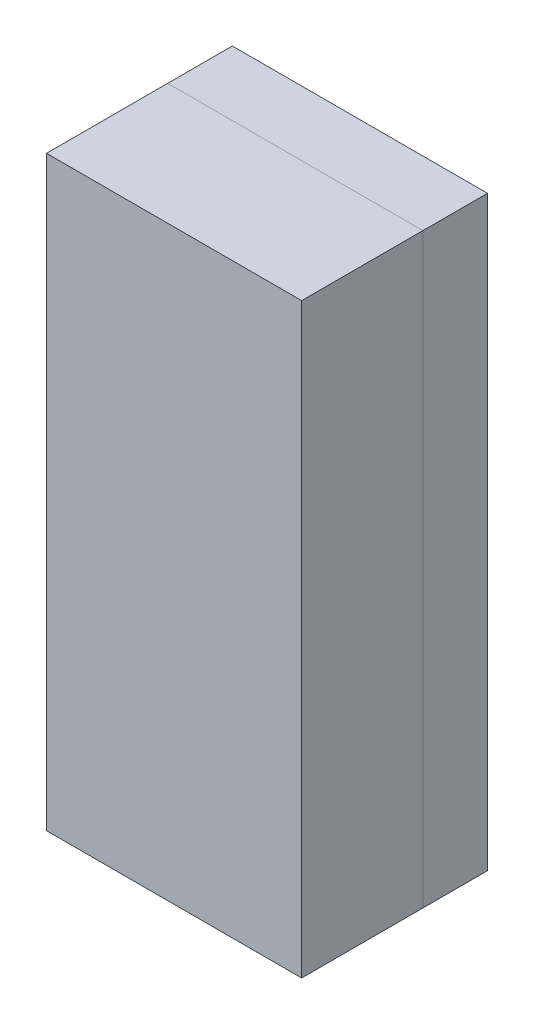
from build123d import *

# Parameters (mm, degrees)
CROQUIS1_W                    = 50
CROQUIS1_H                    = 200
SALIENTE_EXTRUIR1_DEPTH       = 30
CORTAR_EXTRUIR1_DEPTH         = 60
CROQUIS3_W                    = 20
CROQUIS3_H                    = 30
SALIENTE_EXTRUIR2_DEPTH       = 5
REDONDEO1_R                   = 10
REDONDEO2_R                   = 10
CROQUIS5_W                    = 6
CROQUIS5_H                    = 6
CROQUIS5_R                    = 8
CROQUIS5_R_2                  = 4
SALIENTE_EXTRUIR3_DEPTH       = 5
ESCALA2_SCALE                 = 1.5
N_CLEO_CAVIDAD2_START         = -78.945007696
N_CLEO_CAVIDAD2_DEPTH         = 157.890015392
N_CLEO_CAVIDAD2_2_DEPTH       = 41.445120732
N_CLEO_CAVIDAD2_START_2       = 37.500113036
N_CLEO_CAVIDAD2_3_DEPTH       = 41.44489466
N_CLEO_CAVIDAD2_START_3       = -37.499886964
N_CLEO_CAVIDAD2_4_DEPTH       = 22.5
N_CLEO_CAVIDAD2_START_4       = 15.000113036
N_CLEO_CAVIDAD2_5_DEPTH       = 22.5
N_CLEO_CAVIDAD2_START_5       = -47.172761026
N_CLEO_CAVIDAD2_6_OUTLINE_W   = 157.890015392
N_CLEO_CAVIDAD2_6_OUTLINE_H   = 363.034016882
N_CLEO_CAVIDAD2_6_OUTLINE_W_2 = 9
N_CLEO_CAVIDAD2_6_OUTLINE_H_2 = 9
N_CLEO_CAVIDAD2_6_OUTLINE_R   = 6
N_CLEO_CAVIDAD2_6_OUTLINE_R_2 = 12
N_CLEO_CAVIDAD2_6_DEPTH       = 40
N_CLEO_CAVIDAD2_7_OUTLINE_R   = 12
N_CLEO_CAVIDAD2_7_OUTLINE_R_2 = 6
N_CLEO_CAVIDAD2_7_OUTLINE_W   = 9
N_CLEO_CAVIDAD2_7_OUTLINE_H   = 9
N_CLEO_CAVIDAD2_7_DEPTH       = 32.5


# Read off the part's stored shape, not the designer's step: Núcleo/Cavidad2
with BuildPart() as part:
    # Croquis1 → Saliente-Extruir1 (new body)
    with BuildSketch(Plane.XY):
        Rectangle(CROQUIS1_W, CROQUIS1_H)
    extrude(amount=SALIENTE_EXTRUIR1_DEPTH)

    # Croquis2 → Cortar-Extruir1 (cut)
    with BuildSketch(Plane.ZY.offset(25)):
        Polygon((15, 100), (30, 60.706463385), (30, 100), align=None)
    extrude(amount=-CORTAR_EXTRUIR1_DEPTH, mode=Mode.SUBTRACT)

    # Croquis3 → Saliente-Extruir2 (add)
    with BuildSketch(Plane(origin=(0, 17.716995079, 46.41089299), x_dir=(1, 0, 0), z_dir=(0, 0.356639588239418, 0.9342420479192843))):
        with Locations((0, 67.044976998)):
            Rectangle(CROQUIS3_W, CROQUIS3_H)
    extrude(amount=SALIENTE_EXTRUIR2_DEPTH)

    # Redondeo1
    # the kernel refuses this fillet: 10 mm, written as the material it takes off along each edge
    with BuildSketch(Plane(origin=(-29.60955221, 60.706463385, 30), x_dir=(0, -1, 0), z_dir=(1, 0, 0))) as redondeo1_piece_1:
        with BuildLine():
            CenterArc((REDONDEO1_R * 0.184382088386, REDONDEO1_R), REDONDEO1_R, 249.106035538, 20.893964462)
            Line((-REDONDEO1_R * 0.172257499853, REDONDEO1_R * 0.0657579520807), (0, 0))
            Line((0, 0), (REDONDEO1_R * 0.184382088386, 0))
        make_face()
    extrude(amount=59.219104419, mode=Mode.SUBTRACT)
    with BuildSketch(Plane(origin=(-42.216106179, 100, 15), x_dir=(0, -0.934242047919284, 0.3566395882394187), z_dir=(1, 0, 0))) as redondeo1_piece_2_section:
        with BuildLine():
            CenterArc((REDONDEO1_R * 0.688644247166, REDONDEO1_R), REDONDEO1_R, 200.893964462, 69.106035538)
            Line((-REDONDEO1_R * 0.245597800753, REDONDEO1_R * 0.643360411761), (0, 0))
            Line((0, 0), (REDONDEO1_R * 0.688644247166, 0))
        make_face()
    redondeo1_piece_2 = extrude(amount=84.432212358, mode=Mode.PRIVATE)
    redondeo1_piece_2 = split(redondeo1_piece_2, bisect_by=Plane(origin=(-10, 94.011560914, 17.386219939), z_dir=(-1, 0, 0)), keep=Keep.TOP, mode=Mode.PRIVATE)
    redondeo1_piece_2 = split(redondeo1_piece_2, bisect_by=Plane(origin=(-26.10805309, 94.400241221, 17.237844274), z_dir=(0, -0.9342420479192843, 0.35663958823941805)), keep=Keep.TOP, mode=Mode.PRIVATE)
    add(redondeo1_piece_2, mode=Mode.SUBTRACT)
    with BuildSketch(Plane(origin=(-42.216106179, 100, 15), x_dir=(0, -0.934242047919284, 0.3566395882394187), z_dir=(1, 0, 0))) as redondeo1_piece_3_section:
        with BuildLine():
            CenterArc((REDONDEO1_R * 0.688644247166, REDONDEO1_R), REDONDEO1_R, 200.893964462, 69.106035538)
            Line((-REDONDEO1_R * 0.245597800753, REDONDEO1_R * 0.643360411761), (0, 0))
            Line((0, 0), (REDONDEO1_R * 0.688644247166, 0))
        make_face()
    redondeo1_piece_3 = extrude(amount=84.432212358, mode=Mode.PRIVATE)
    redondeo1_piece_3 = split(redondeo1_piece_3, bisect_by=Plane(origin=(-10, 98.665500542, 13.974903393), z_dir=(-1, 0, 0)), keep=Keep.TOP, mode=Mode.PRIVATE)
    redondeo1_piece_3 = split(redondeo1_piece_3, bisect_by=Plane(origin=(-26.10805309, 93.855575449, 15.811054644), z_dir=(0, 0.9342420479192843, -0.35663958823941805)), keep=Keep.TOP, mode=Mode.PRIVATE)
    add(redondeo1_piece_3, mode=Mode.SUBTRACT)
    with BuildSketch(Plane(origin=(-42.216106179, 100, 15), x_dir=(0, -0.934242047919284, 0.3566395882394187), z_dir=(1, 0, 0))) as redondeo1_piece_4_section:
        with BuildLine():
            CenterArc((REDONDEO1_R * 0.688644247166, REDONDEO1_R), REDONDEO1_R, 200.893964462, 69.106035538)
            Line((-REDONDEO1_R * 0.245597800753, REDONDEO1_R * 0.643360411761), (0, 0))
            Line((0, 0), (REDONDEO1_R * 0.688644247166, 0))
        make_face()
    redondeo1_piece_4 = extrude(amount=84.432212358, mode=Mode.PRIVATE)
    redondeo1_piece_4 = split(redondeo1_piece_4, bisect_by=Plane(origin=(-10, 98.665500542, 13.974903393), z_dir=(1, 0, 0)), keep=Keep.TOP, mode=Mode.PRIVATE)
    redondeo1_piece_4 = split(redondeo1_piece_4, bisect_by=Plane(origin=(0, 93.855575449, 15.811054644), z_dir=(0, 0.9342420479192843, -0.35663958823941805)), keep=Keep.TOP, mode=Mode.PRIVATE)
    redondeo1_piece_4 = split(redondeo1_piece_4, bisect_by=Plane(origin=(10, 98.665500542, 13.974903393), z_dir=(-1, 0, 0)), keep=Keep.TOP, mode=Mode.PRIVATE)
    add(redondeo1_piece_4, mode=Mode.SUBTRACT)
    with BuildSketch(Plane(origin=(-42.216106179, 100, 15), x_dir=(0, -0.934242047919284, 0.3566395882394187), z_dir=(1, 0, 0))) as redondeo1_piece_5_section:
        with BuildLine():
            CenterArc((REDONDEO1_R * 0.688644247166, REDONDEO1_R), REDONDEO1_R, 200.893964462, 69.106035538)
            Line((-REDONDEO1_R * 0.245597800753, REDONDEO1_R * 0.643360411761), (0, 0))
            Line((0, 0), (REDONDEO1_R * 0.688644247166, 0))
        make_face()
    redondeo1_piece_5 = extrude(amount=84.432212358, mode=Mode.PRIVATE)
    redondeo1_piece_5 = split(redondeo1_piece_5, bisect_by=Plane(origin=(26.10805309, 94.400241221, 17.237844274), z_dir=(0, -0.9342420479192843, 0.35663958823941805)), keep=Keep.TOP, mode=Mode.PRIVATE)
    redondeo1_piece_5 = split(redondeo1_piece_5, bisect_by=Plane(origin=(10, 94.011560914, 17.386219939), z_dir=(1, 0, 0)), keep=Keep.TOP, mode=Mode.PRIVATE)
    add(redondeo1_piece_5, mode=Mode.SUBTRACT)
    with BuildSketch(Plane(origin=(-42.216106179, 100, 15), x_dir=(0, -0.934242047919284, 0.3566395882394187), z_dir=(1, 0, 0))) as redondeo1_piece_6_section:
        with BuildLine():
            CenterArc((REDONDEO1_R * 0.688644247166, REDONDEO1_R), REDONDEO1_R, 200.893964462, 69.106035538)
            Line((-REDONDEO1_R * 0.245597800753, REDONDEO1_R * 0.643360411761), (0, 0))
            Line((0, 0), (REDONDEO1_R * 0.688644247166, 0))
        make_face()
    redondeo1_piece_6 = extrude(amount=84.432212358, mode=Mode.PRIVATE)
    redondeo1_piece_6 = split(redondeo1_piece_6, bisect_by=Plane(origin=(26.10805309, 93.855575449, 15.811054644), z_dir=(0, 0.9342420479192843, -0.35663958823941805)), keep=Keep.TOP, mode=Mode.PRIVATE)
    redondeo1_piece_6 = split(redondeo1_piece_6, bisect_by=Plane(origin=(10, 98.665500542, 13.974903393), z_dir=(1, 0, 0)), keep=Keep.TOP, mode=Mode.PRIVATE)
    add(redondeo1_piece_6, mode=Mode.SUBTRACT)

    # Redondeo2
    # the kernel refuses this fillet: 10 mm, written as the material it takes off along each edge
    with BuildSketch(Plane(origin=(31.650635095, 68.122798915, 32.520804063), x_dir=(0, 0.9342420479192848, -0.3566395882394171), z_dir=(-1, 0, 0))) as redondeo2_piece_1:
        with BuildLine():
            CenterArc((8.660254038, 10), REDONDEO2_R, 210, 60)
            Line((0, 5), (-0.173205081, 4.9))
            ThreePointArc((-0.173205081, 4.9), (-0.2, 2.5), (-0.2, 0))
            Line((-0.2, 0), (0, -0.2))
            Line((0, -0.2), (8.660254038, -0.2))
            Line((8.660254038, -0.2), (8.660254038, 0))
        make_face()
    extrude(amount=63.301270189, mode=Mode.SUBTRACT)
    with BuildSketch(Plane(origin=(-31.703453679, 96.150060353, 21.821616416), x_dir=(0, -0.3566395882395135, -0.9342420479192478), z_dir=(1, 0, 0))) as redondeo2_piece_2:
        with BuildLine():
            CenterArc((10, -8.681381471), REDONDEO2_R, 119.757004223, 60.242995777)
            Line((0, -8.681381471), (-0.2, -8.681381471))
            Line((-0.2, -8.681381471), (-0.2, 0))
            Line((-0.2, 0), (0, 0.2))
            ThreePointArc((0, 0.2), (2.518386828, 0.2), (4.937509129, 0.173627629))
            Line((4.937509129, 0.173627629), (5.036773655, 0))
        make_face()
    extrude(amount=63.406907357, mode=Mode.SUBTRACT)

    # Croquis5 → Saliente-Extruir3 (add)
    with BuildSketch(Plane(origin=(0, 0, 0), x_dir=(-1, 0, 0), z_dir=(0, 0, -1))):
        Polygon((-2.5, 80), (-2.5, 72.5), (-10, 72.5), (-10, 67.5), (-2.5, 67.5), (-2.5, 60), (2.5, 60), (2.5, 67.5), (10, 67.5), (10, 72.5), (2.5, 72.5), (2.5, 80), align=None)
        with Locations((-17.908573371, -75.072215566)):
            Rectangle(CROQUIS5_W, CROQUIS5_H)
        with Locations((18.091426629, -75.072215566)):
            Rectangle(CROQUIS5_W, CROQUIS5_H)
        with Locations((-5.908573371, -75.072215566)):
            Rectangle(CROQUIS5_W, CROQUIS5_H)
        with Locations((6.091426629, -75.072215566)):
            Rectangle(CROQUIS5_W, CROQUIS5_H)
        with Locations(Location((0, 26, 0), (0, 0, 180))):
            Circle(CROQUIS5_R)
        with Locations(Location((0, 0, 0), (0, 0, 180))):
            Circle(CROQUIS5_R_2)
        with Locations(Location((-12.5, 0, 0), (0, 0, 180))):
            Circle(CROQUIS5_R_2)
        with Locations(Location((12.5, 0, 0), (0, 0, 180))):
            Circle(CROQUIS5_R_2)
        with Locations(Location((0, -50, 0), (0, 0, 180))):
            Circle(CROQUIS5_R_2)
        with Locations(Location((0, -62.5, 0), (0, 0, 180))):
            Circle(CROQUIS5_R_2)
    extrude(amount=SALIENTE_EXTRUIR3_DEPTH)


with BuildPart() as part_1:
    # Escala2: scaled about (-0.000226072, -3.832135101, 14.345522052)
    add(part.part.scale(ESCALA2_SCALE).moved(Location((0.000113036, 1.91606755, -7.172761026))))


with BuildPart() as body_2:
    # Núcleo/Cavidad2 outline → Núcleo/Cavidad2 (new body)
    with BuildSketch(Plane.YZ.offset(N_CLEO_CAVIDAD2_START)):
        with BuildLine():
            Line((181.517008441, 67.827238974), (-181.517008441, 67.827238974))
            Line((-181.517008441, 67.827238974), (-181.517008441, -7.172761026))
            Line((-181.517008441, -7.172761026), (-148.08393245, -7.172761026))
            Line((-148.08393245, -7.172761026), (-148.08393245, 37.827238974))
            Line((-148.08393245, 37.827238974), (90.210031302, 37.827238974))
            ThreePointArc((90.210031302, 37.827238974), (92.929915419, 37.578585705), (95.559625126, 36.840869693))
            Line((95.559625126, 36.840869693), (101.425469011, 34.601629709))
            ThreePointArc((101.425469011, 34.601629709), (108.512901093, 37.772887312), (116.236426125, 36.975560917))
            Line((116.236426125, 36.975560917), (133.975390672, 30.203850068))
            ThreePointArc((133.975390672, 30.203850068), (140.285533356, 25.626878958), (143.446688755, 18.501314996))
            ThreePointArc((143.446688755, 18.501314996), (149.623532248, 12.967540195), (151.91606755, 4.997575266))
            Line((151.91606755, 4.997575266), (151.91606755, -7.172761026))
            Line((151.91606755, -7.172761026), (181.517008441, -7.172761026))
            Line((181.517008441, -7.172761026), (181.517008441, 67.827238974))
        make_face()
    extrude(amount=N_CLEO_CAVIDAD2_DEPTH)

    # N_cleo_Cavidad2 2 outline → N_cleo_Cavidad2 2 (add)
    with BuildSketch(Plane.YZ.offset(N_CLEO_CAVIDAD2_START)):
        with BuildLine():
            Line((-148.08393245, 37.827238974), (-148.08393245, -7.172761026))
            Line((-148.08393245, -7.172761026), (151.91606755, -7.172761026))
            Line((151.91606755, -7.172761026), (151.91606755, 4.997575266))
            ThreePointArc((151.91606755, 4.997575266), (149.623532248, 12.967540195), (143.446688755, 18.501314996))
            ThreePointArc((143.446688755, 18.501314996), (140.285533356, 25.626878958), (133.975390672, 30.203850068))
            Line((133.975390672, 30.203850068), (116.236426125, 36.975560917))
            ThreePointArc((116.236426125, 36.975560917), (108.512901093, 37.772887312), (101.425469011, 34.601629709))
            Line((101.425469011, 34.601629709), (95.559625126, 36.840869693))
            ThreePointArc((95.559625126, 36.840869693), (92.929915419, 37.578585705), (90.210031302, 37.827238974))
            Line((90.210031302, 37.827238974), (-148.08393245, 37.827238974))
        make_face()
    extrude(amount=N_CLEO_CAVIDAD2_2_DEPTH)

    # N_cleo_Cavidad2 3 outline → N_cleo_Cavidad2 3 (add)
    with BuildSketch(Plane.YZ.offset(N_CLEO_CAVIDAD2_START_2)):
        with BuildLine():
            Line((-148.08393245, 37.827238974), (-148.08393245, -7.172761026))
            Line((-148.08393245, -7.172761026), (151.91606755, -7.172761026))
            Line((151.91606755, -7.172761026), (151.91606755, 4.997575266))
            ThreePointArc((151.91606755, 4.997575266), (149.623532248, 12.967540195), (143.446688755, 18.501314996))
            ThreePointArc((143.446688755, 18.501314996), (140.285533356, 25.626878958), (133.975390672, 30.203850068))
            Line((133.975390672, 30.203850068), (116.236426125, 36.975560917))
            ThreePointArc((116.236426125, 36.975560917), (108.512901093, 37.772887312), (101.425469011, 34.601629709))
            Line((101.425469011, 34.601629709), (95.559625126, 36.840869693))
            ThreePointArc((95.559625126, 36.840869693), (92.929915419, 37.578585705), (90.210031302, 37.827238974))
            Line((90.210031302, 37.827238974), (-148.08393245, 37.827238974))
        make_face()
    extrude(amount=N_CLEO_CAVIDAD2_3_DEPTH)

    # N_cleo_Cavidad2 4 outline → N_cleo_Cavidad2 4 (add)
    with BuildSketch(Plane.YZ.offset(N_CLEO_CAVIDAD2_START_3)):
        with BuildLine():
            ThreePointArc((142.265661374, 19.011205985), (142.861643593, 18.768926889), (143.446688755, 18.501314996))
            ThreePointArc((143.446688755, 18.501314996), (140.285533356, 25.626878958), (133.975390672, 30.203850068))
            Line((133.975390672, 30.203850068), (116.236426125, 36.975560917))
            ThreePointArc((116.236426125, 36.975560917), (108.512901093, 37.772887312), (101.425469011, 34.601629709))
            Line((101.425469011, 34.601629709), (142.265661374, 19.011205985))
        make_face()
    extrude(amount=N_CLEO_CAVIDAD2_4_DEPTH)

    # N_cleo_Cavidad2 5 outline → N_cleo_Cavidad2 5 (add)
    with BuildSketch(Plane.YZ.offset(N_CLEO_CAVIDAD2_START_4)):
        with BuildLine():
            ThreePointArc((142.265661374, 19.011205985), (142.861643593, 18.768926889), (143.446688755, 18.501314996))
            ThreePointArc((143.446688755, 18.501314996), (140.285533356, 25.626878958), (133.975390672, 30.203850068))
            Line((133.975390672, 30.203850068), (116.236426125, 36.975560917))
            ThreePointArc((116.236426125, 36.975560917), (108.512901093, 37.772887312), (101.425469011, 34.601629709))
            Line((101.425469011, 34.601629709), (142.265661374, 19.011205985))
        make_face()
    extrude(amount=N_CLEO_CAVIDAD2_5_DEPTH)


with BuildPart() as body_3:
    # N_cleo_Cavidad2 6 outline → N_cleo_Cavidad2 6 (new body)
    with BuildSketch(Plane.XY.offset(N_CLEO_CAVIDAD2_START_5)):
        Rectangle(N_CLEO_CAVIDAD2_6_OUTLINE_W, N_CLEO_CAVIDAD2_6_OUTLINE_H)
        with Locations((-27.137026908, -110.692255799)):
            Rectangle(N_CLEO_CAVIDAD2_6_OUTLINE_W_2, N_CLEO_CAVIDAD2_6_OUTLINE_H_2, mode=Mode.SUBTRACT)
        with Locations((-9.137026908, -110.692255799)):
            Rectangle(N_CLEO_CAVIDAD2_6_OUTLINE_W_2, N_CLEO_CAVIDAD2_6_OUTLINE_H_2, mode=Mode.SUBTRACT)
        with Locations((8.862973092, -110.692255799)):
            Rectangle(N_CLEO_CAVIDAD2_6_OUTLINE_W_2, N_CLEO_CAVIDAD2_6_OUTLINE_H_2, mode=Mode.SUBTRACT)
        with Locations((0.000113036, -91.83393245)):
            Circle(N_CLEO_CAVIDAD2_6_OUTLINE_R, mode=Mode.SUBTRACT)
        with Locations((26.862973092, -110.692255799)):
            Rectangle(N_CLEO_CAVIDAD2_6_OUTLINE_W_2, N_CLEO_CAVIDAD2_6_OUTLINE_H_2, mode=Mode.SUBTRACT)
        with Locations((0.000113036, -73.08393245)):
            Circle(N_CLEO_CAVIDAD2_6_OUTLINE_R, mode=Mode.SUBTRACT)
        with Locations((-18.749886964, 1.91606755)):
            Circle(N_CLEO_CAVIDAD2_6_OUTLINE_R, mode=Mode.SUBTRACT)
        with Locations((0.000113036, 1.91606755)):
            Circle(N_CLEO_CAVIDAD2_6_OUTLINE_R, mode=Mode.SUBTRACT)
        with Locations((18.750113036, 1.91606755)):
            Circle(N_CLEO_CAVIDAD2_6_OUTLINE_R, mode=Mode.SUBTRACT)
        with Locations((0.000113036, 40.91606755)):
            Circle(N_CLEO_CAVIDAD2_6_OUTLINE_R_2, mode=Mode.SUBTRACT)
        Polygon((-3.749886964, 91.91606755), (-3.749886964, 103.16606755), (-14.999886964, 103.16606755), (-14.999886964, 110.66606755), (-3.749886964, 110.66606755), (-3.749886964, 121.91606755), (3.750113036, 121.91606755), (3.750113036, 110.66606755), (15.000113036, 110.66606755), (15.000113036, 103.16606755), (3.750113036, 103.16606755), (3.750113036, 91.91606755), align=None, mode=Mode.SUBTRACT)
    extrude(amount=N_CLEO_CAVIDAD2_6_DEPTH)

    # N_cleo_Cavidad2 7 outline → N_cleo_Cavidad2 7 (add)
    with BuildSketch(Plane.XY.offset(N_CLEO_CAVIDAD2_START_5)):
        Polygon((-14.999886964, 103.16606755), (-3.749886964, 103.16606755), (-3.749886964, 91.91606755), (3.750113036, 91.91606755), (3.750113036, 103.16606755), (15.000113036, 103.16606755), (15.000113036, 110.66606755), (3.750113036, 110.66606755), (3.750113036, 121.91606755), (-3.749886964, 121.91606755), (-3.749886964, 110.66606755), (-14.999886964, 110.66606755), align=None)
        with Locations((0.000113036, 40.91606755)):
            Circle(N_CLEO_CAVIDAD2_7_OUTLINE_R)
        with Locations((18.750113036, 1.91606755)):
            Circle(N_CLEO_CAVIDAD2_7_OUTLINE_R_2)
        with Locations((0.000113036, -73.08393245)):
            Circle(N_CLEO_CAVIDAD2_7_OUTLINE_R_2)
        with Locations((0.000113036, -91.83393245)):
            Circle(N_CLEO_CAVIDAD2_7_OUTLINE_R_2)
        with Locations((26.862973092, -110.692255799)):
            Rectangle(N_CLEO_CAVIDAD2_7_OUTLINE_W, N_CLEO_CAVIDAD2_7_OUTLINE_H)
        with Locations((8.862973092, -110.692255799)):
            Rectangle(N_CLEO_CAVIDAD2_7_OUTLINE_W, N_CLEO_CAVIDAD2_7_OUTLINE_H)
        with Locations((-9.137026908, -110.692255799)):
            Rectangle(N_CLEO_CAVIDAD2_7_OUTLINE_W, N_CLEO_CAVIDAD2_7_OUTLINE_H)
        with Locations((-27.137026908, -110.692255799)):
            Rectangle(N_CLEO_CAVIDAD2_7_OUTLINE_W, N_CLEO_CAVIDAD2_7_OUTLINE_H)
        with Locations((0.000113036, 1.91606755)):
            Circle(N_CLEO_CAVIDAD2_7_OUTLINE_R_2)
        with Locations((-18.749886964, 1.91606755)):
            Circle(N_CLEO_CAVIDAD2_7_OUTLINE_R_2)
    extrude(amount=N_CLEO_CAVIDAD2_7_DEPTH)


solid = Compound([part_1.part, body_2.part, body_3.part])
